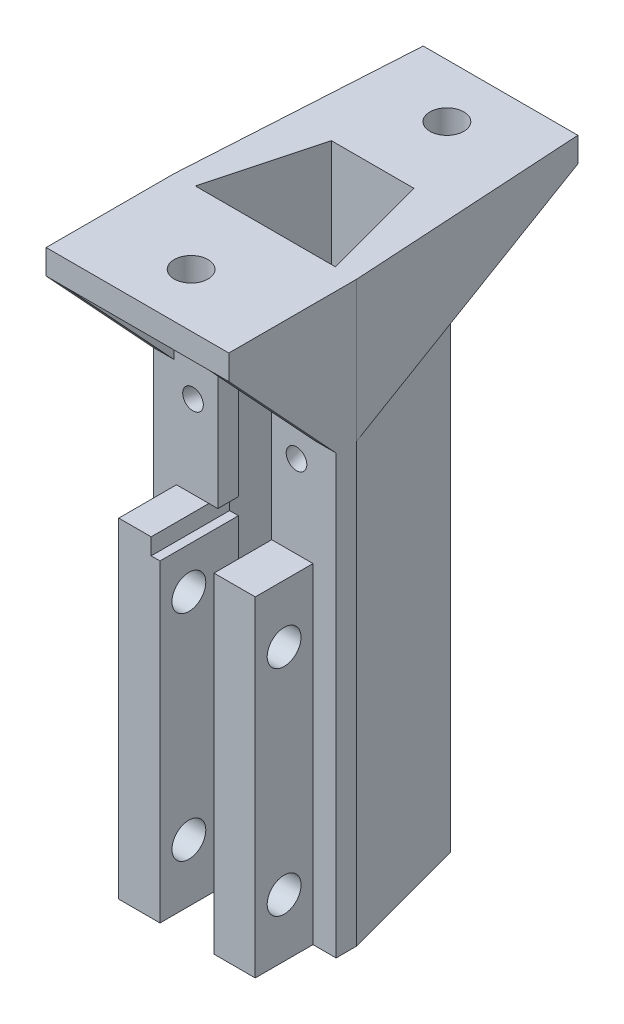
from build123d import *

# Parameters (mm, degrees)
BOSS_EXTRUDE1_DEPTH      = 40
SKETCH3_R                = 2.05
CUT_EXTRUDE2_DEPTH       = 40
BOSS_EXTRUDE2_DEPTH      = 30
SKETCH7_W                = 4.5
SKETCH7_H                = 2
CUT_EXTRUDE3_DEPTH       = 76.328383431
SKETCH10_W               = 4.5
SKETCH10_H               = 75
CUT_EXTRUDE5_DEPTH       = 1.5
SKETCH13_W               = 2.8
SKETCH13_H               = 2
CUT_EXTRUDE7_DEPTH       = 1.5
SKETCH15_W               = 1.5
SKETCH15_H               = 2
CUT_EXTRUDE8_DEPTH       = 18.5
SKETCH16_R               = 1.25
CUT_EXTRUDE9_DEPTH       = 3.5
SKETCH17_R               = 1.25
CUT_EXTRUDE10_DEPTH      = 3.5
SKETCH18_W               = 22.143059906
SKETCH18_H               = 3
BOSS_EXTRUDE4_DEPTH      = 15.5
BOSS_EXTRUDE5_DEPTH      = 13
BOSS_EXTRUDE5_DEPTH_BACK = 2
SKETCH19_W               = 13.83663494
SKETCH19_H               = 3
BOSS_EXTRUDE6_DEPTH      = 2.5
BOSS_EXTRUDE8_DEPTH      = 2.5
BOSS_EXTRUDE9_DEPTH      = 4.2
BOSS_EXTRUDE10_DEPTH     = 4.2
SKETCH25_R               = 2.05
CUT_EXTRUDE12_DEPTH      = 3.5
CUT_EXTRUDE13_DEPTH      = 71.528016285
CUT_EXTRUDE14_DEPTH      = 71.528016285


with BuildPart() as part:
    # Sketch2 → Boss-Extrude1 (new body)
    with BuildSketch(Plane(origin=(0, 0, 0), x_dir=(1, 0, 0), z_dir=(0, 1, 0))):
        Polygon((5.768335638, 3.843580014), (-8.068299302, 3.843580014), (-12.221511785, -11.656419986), (-12.221511785, -14.156419986), (-9.421511785, -14.156419986), (-9.421511785, -21.156419986), (-4.421511785, -21.156419986), (-4.421511785, -11.656419986), (-9.633321334, -11.656419986), (-6.149981832, 1.343580014), (3.850018168, 1.343580014), (7.33335767, -11.656419986), (2.121548121, -11.656419986), (2.121548121, -21.156419986), (7.121548121, -21.156419986), (7.121548121, -14.156419986), (9.921548121, -14.156419986), (9.921548121, -11.656419986), align=None)
    extrude(amount=BOSS_EXTRUDE1_DEPTH)

    # Sketch3 → Cut-Extrude2 (cut)
    with BuildSketch(Plane.ZY.offset(9.421511785)):
        with Locations((17.656419986, 33)):
            Circle(SKETCH3_R)
        with Locations((17.656419986, 7)):
            Circle(SKETCH3_R)
    extrude(amount=-CUT_EXTRUDE2_DEPTH, mode=Mode.SUBTRACT)

    # Sketch4 → Boss-Extrude2 (add)
    with BuildSketch(Plane(origin=(0, 40, 0), x_dir=(1, 0, 0), z_dir=(0, 1, 0))):
        Polygon((-4.421511785, -11.656419986), (-9.633321334, -11.656419986), (-6.149981832, 1.343580014), (3.850018168, 1.343580014), (7.33335767, -11.656419986), (2.121548121, -11.656419986), (2.121548121, -14.156419986), (7.121548121, -14.156419986), (9.921548121, -14.156419986), (9.921548121, -11.656419986), (5.768335638, 3.843580014), (-8.068299302, 3.843580014), (-12.221511785, -11.656419986), (-12.221511785, -14.156419986), (-9.421511785, -14.156419986), (-4.421511785, -14.156419986), align=None)
    extrude(amount=BOSS_EXTRUDE2_DEPTH)

    # Sketch7 → Cut-Extrude3 (cut, through all)
    with BuildSketch(Plane(origin=(0, 0, -3.843580014), x_dir=(-1, 0, 0), z_dir=(0, 0, -1))):
        with Locations((3.241664362, 39)):
            Rectangle(SKETCH7_W, SKETCH7_H)
    extrude(amount=-CUT_EXTRUDE3_DEPTH, mode=Mode.SUBTRACT)

    # Sketch10 → Cut-Extrude5 (cut)
    with BuildSketch(Plane(origin=(0, 0, -3.843580014), x_dir=(-1, 0, 0), z_dir=(0, 0, -1))):
        with Locations((3.241664362, 77.5)):
            Rectangle(SKETCH10_W, SKETCH10_H)
    extrude(amount=-CUT_EXTRUDE5_DEPTH, mode=Mode.SUBTRACT)

    # Sketch13 → Cut-Extrude7 (cut)
    with BuildSketch(Plane(origin=(0, 0, -2.343580014), x_dir=(-1, 0, 0), z_dir=(0, 0, -1))):
        with Locations((6.891664362, 41)):
            Rectangle(SKETCH13_W, SKETCH13_H)
    extrude(amount=CUT_EXTRUDE7_DEPTH, mode=Mode.SUBTRACT)

    # Sketch15 → Cut-Extrude8 (cut, along a direction that is not the sketch's normal)
    with BuildSketch(Plane(origin=(0, 0, -3.843580014), x_dir=(-1, 0, 0), z_dir=(0, 0, -1))):
        with Locations((7.318299302, 41)):
            Rectangle(SKETCH15_W, SKETCH15_H)
    extrude(amount=-CUT_EXTRUDE8_DEPTH, dir=(0.25881904510252474, 0, -0.9659258262890672), mode=Mode.SUBTRACT)

    # Sketch16 → Cut-Extrude9 (cut, along a direction that is not the sketch's normal)
    with BuildSketch(Plane.XY.offset(14.156419986)):
        with Locations((-7.421511785, 50)):
            Circle(SKETCH16_R)
    extrude(amount=-CUT_EXTRUDE9_DEPTH, dir=(-0.2588190451025246, 0, 0.9659258262890672), mode=Mode.SUBTRACT)

    # Sketch17 → Cut-Extrude10 (cut, along a direction that is not the sketch's normal)
    with BuildSketch(Plane.XY.offset(14.156419986)):
        with Locations((5.121548121, 50)):
            Circle(SKETCH17_R)
    extrude(amount=-CUT_EXTRUDE10_DEPTH, dir=(0.25881904510251796, 0, 0.9659258262890691), mode=Mode.SUBTRACT)

    # Sketch18 → Boss-Extrude4 (add)
    with BuildSketch(Plane(origin=(0, 0, 11.656419986), x_dir=(-1, 0, 0), z_dir=(0, 0, -1))):
        with Locations((1.149981832, 68.5)):
            Rectangle(SKETCH18_W, SKETCH18_H)
    extrude(amount=-BOSS_EXTRUDE4_DEPTH)

    # Sketch19 → Boss-Extrude5 (add, two sides: drawn at the far end of the back side and taken through both)
    with BuildSketch(Plane(origin=(0, 0, -3.843580014), x_dir=(-1, 0, 0), z_dir=(0, 0, -1)).offset(-BOSS_EXTRUDE5_DEPTH_BACK)):
        with Locations((1.149981832, 68.5)):
            Rectangle(SKETCH19_W, SKETCH19_H)
    extrude(amount=BOSS_EXTRUDE5_DEPTH + BOSS_EXTRUDE5_DEPTH_BACK)

    # Sketch21 → Boss-Extrude6 (add)
    with BuildSketch(Plane.ZY.offset(12.221511785)):
        Polygon((27.156419986, 67), (14.156419986, 53), (14.156419986, 67), align=None)
    extrude(amount=-BOSS_EXTRUDE6_DEPTH)

    # Sketch22 → Boss-Extrude8 (add)
    with BuildSketch(Plane(origin=(9.921548121, 0, 0), x_dir=(0, 0, -1), z_dir=(1, 0, 0))):
        Polygon((-27.156419986, 67), (-14.156419986, 67), (-14.156419986, 53), align=None)
    extrude(amount=-BOSS_EXTRUDE8_DEPTH)

    # Sketch23 → Boss-Extrude9 (add)
    with BuildSketch(Plane(origin=(9.921548121, 0, 0), x_dir=(0, 0, -1), z_dir=(1, 0, 0))):
        Polygon((-11.656419986, 70), (-11.656419986, 53), (16.843580014, 67), (16.843580014, 70), align=None)
    extrude(amount=-BOSS_EXTRUDE9_DEPTH)

    # Sketch24 → Boss-Extrude10 (add)
    with BuildSketch(Plane.ZY.offset(12.221511785)):
        Polygon((11.656419986, 70), (-16.843580014, 70), (-16.843580014, 67), (11.656419986, 53), align=None)
    extrude(amount=-BOSS_EXTRUDE10_DEPTH)

    # Sketch25 → Cut-Extrude12 (cut)
    with BuildSketch(Plane(origin=(0, 70, 0), x_dir=(1, 0, 0), z_dir=(0, 1, 0))):
        with Locations((-1.149981694, 10.343580014)):
            Circle(SKETCH25_R)
        with Locations((-1.149981723, -20.656419986)):
            Circle(SKETCH25_R)
    extrude(amount=-CUT_EXTRUDE12_DEPTH, mode=Mode.SUBTRACT)

    # Sketch26 → Cut-Extrude13 (cut, through all, along a direction that is not the sketch's normal)
    with BuildSketch(Plane(origin=(0, 47.309855268, 23.239928904), x_dir=(-1, 0, 0), z_dir=(-4.742047126241555e-14, -0.8975543264374147, -0.4409038796534669))):
        Polygon((-5.721548121, 12.905635433), (-7.33335767, 12.905635433), (-5.721548121, 19.607575306), align=None)
        Polygon((8.021511785, 12.905635433), (8.021511785, 19.607575306), (9.633321334, 12.905635433), align=None)
    extrude(amount=-CUT_EXTRUDE13_DEPTH, dir=(0, -1, 0), mode=Mode.SUBTRACT)

    # Sketch27 → Cut-Extrude14 (cut, through all, along a direction that is not the sketch's normal)
    with BuildSketch(Plane(origin=(0, 47.309855268, 23.239928904), x_dir=(-1, 0, 0), z_dir=(0, -0.8975543264374147, -0.440903879653467))):
        Polygon((12.221511785, 12.905635433), (10.521511785, 44.658588051), (12.221511785, 44.658588051), align=None)
        Polygon((-9.921548121, 12.905635433), (-9.921548121, 44.658588051), (-8.221548121, 44.658588051), align=None)
    extrude(amount=-CUT_EXTRUDE14_DEPTH, dir=(0, -1, 0), mode=Mode.SUBTRACT)


solid = part.part
